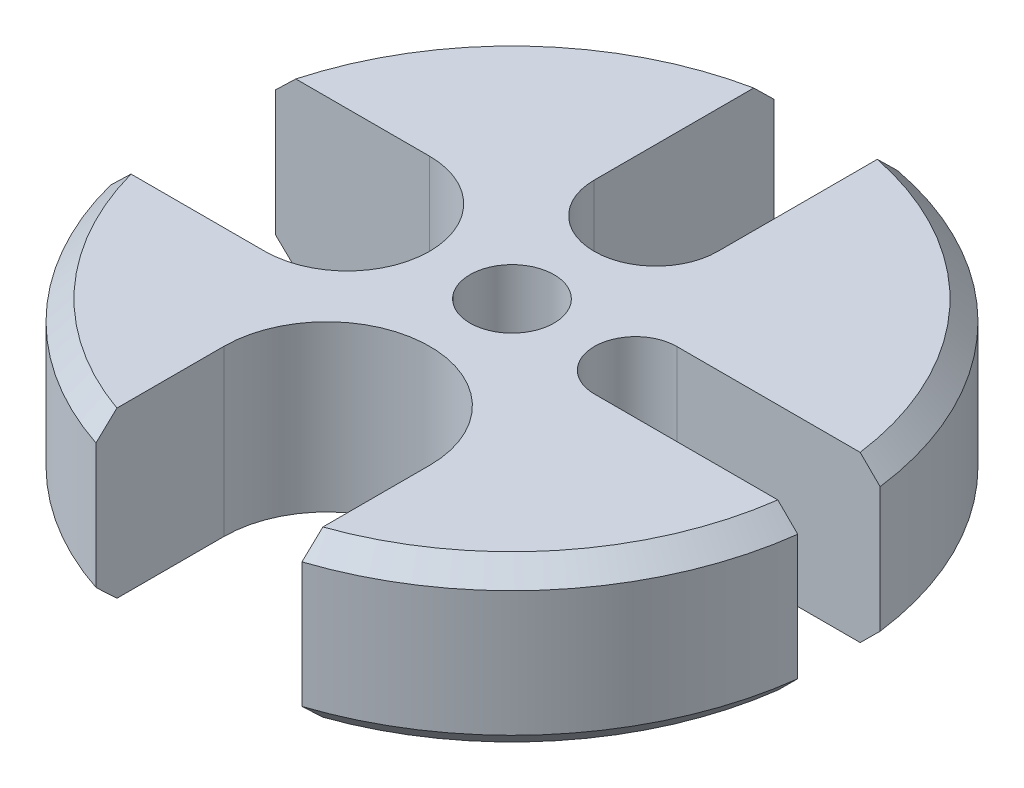
from build123d import *

# Parameters (mm, degrees)
SKETCH1_R           = 25.4
BOSS_EXTRUDE1_DEPTH = 12.7
HOLE1_D             = 6.477
CUT_EXTRUDE4_DEPTH  = 39.1
CIRPATTERN1_DEPTH   = 12.7
CHAMFER1_SIZE       = 1.524


# Read off the part's stored shape, not the designer's step: CirPattern1
with BuildPart() as part:
    # Sketch1 → Boss-Extrude1 (new body)
    with BuildSketch(Plane(origin=(0, 0, 0), x_dir=(1, 0, 0), z_dir=(0, 1, 0))):
        with Locations(Location((0, 0, 0), (0, 0, 270))):
            Circle(SKETCH1_R)
    extrude(amount=BOSS_EXTRUDE1_DEPTH)

    # Hole1 (through all)
    with Locations(Plane(origin=(0, 12.7, 0), x_dir=(1, 0, 0), z_dir=(0, 1, 0))):
        with Locations((0, 0)):
            Hole(HOLE1_D / 2)

    # Sketch4 → Cut-Extrude4 (cut, symmetric)
    with BuildSketch(Plane(origin=(0, 12.7, 0), x_dir=(1, 0, 0), z_dir=(0, 1, 0))):
        with BuildLine():
            Line((-4.7625, 152.335221274), (-4.7625, 24.949520912))
            Line((-4.7625, 24.949520912), (-4.7625, 11.0998))
            ThreePointArc((-4.7625, 11.0998), (0, 6.3373), (4.7625, 11.0998))
            Line((4.7625, 11.0998), (4.7625, 24.949520912))
            Line((4.7625, 24.949520912), (4.7625, 152.335221274))
            Line((4.7625, 152.335221274), (4.7625, 407.106621997))
            Line((4.7625, 407.106621997), (-4.7625, 407.106621997))
            Line((-4.7625, 407.106621997), (-4.7625, 152.335221274))
        make_face()
    extrude(amount=CUT_EXTRUDE4_DEPTH, both=True, mode=Mode.SUBTRACT)

    # CirPattern1 outline → CirPattern1 (cut)
    with BuildSketch(Plane(origin=(0, 0, 0), x_dir=(1, 0, 0), z_dir=(0, 1, 0))):
        with BuildLine():
            ThreePointArc((-24.593444248, 6.35), (-25.4, 0), (-24.593444248, -6.35))
            Line((-24.593444248, -6.35), (-12.7, -6.35))
            ThreePointArc((-12.7, -6.35), (-6.35, 0), (-12.7, 6.35))
            Line((-12.7, 6.35), (-24.593444248, 6.35))
        make_face()
        with BuildLine():
            Line((9.525, -3.175), (25.200781238, -3.175))
            ThreePointArc((25.200781238, -3.175), (25.4, 0), (25.200781238, 3.175))
            Line((25.200781238, 3.175), (9.525, 3.175))
            ThreePointArc((9.525, 3.175), (6.35, 0), (9.525, -3.175))
        make_face()
        with BuildLine():
            Line((-7.9375, -14.2748), (-7.9375, -24.127911094))
            ThreePointArc((-7.9375, -24.127911094), (0, -25.4), (7.9375, -24.127911094))
            Line((7.9375, -24.127911094), (7.9375, -14.2748))
            ThreePointArc((7.9375, -14.2748), (0, -6.3373), (-7.9375, -14.2748))
        make_face()
    extrude(amount=CIRPATTERN1_DEPTH, mode=Mode.SUBTRACT)

    # Chamfer1
    chamfer1_edges = [part.edges().sort_by_distance(p)[0] for p in [
        (-17.37608731, 0, -18.526510459),
        (-17.37608731, 12.7, -18.526510459),
        (-18.535887196, 0, 17.366084356),
        (-18.535887196, 12.7, 17.366084356),
        (19.603380874, 0, 16.151391839),
        (19.603380874, 12.7, 16.151391839),
        (18.519773105, 0, -17.383267936),
        (18.519773105, 12.7, -17.383267936),
    ]]
    chamfer(chamfer1_edges, length=CHAMFER1_SIZE)


solid = part.part
